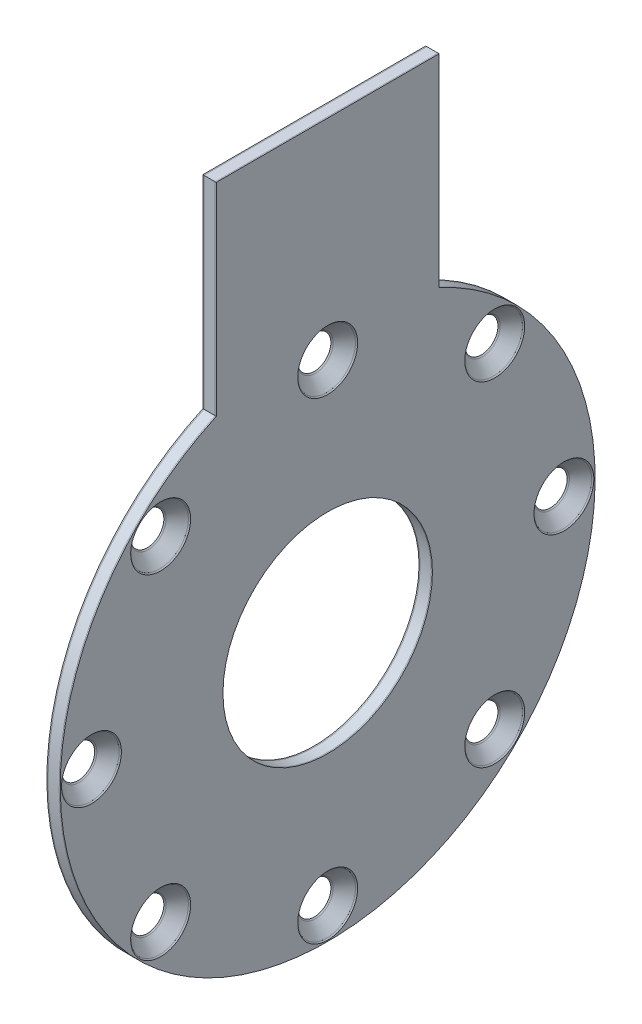
from build123d import *

# Parameters (mm, degrees)
SKETCH1_R                                    = 23.5
BOSS_EXTRUDE1_DEPTH                          = 0.25
SKETCH4_R                                    = 23.5
BOSS_EXTRUDE4_DEPTH                          = 2.5
SKETCH5_R                                    = 23.5
BOSS_EXTRUDE5_DEPTH                          = 0.25
CSK_FOR_M6_HEX_SOCKET_COUNTERSUNK_CA_2_COUNT = 2
CSK_FOR_M6_HEX_SOCKET_COUNTERSUNK_CA_2_PITCH = 40.564443831
CSK_FOR_M6_HEX_SOCKET_COUNTERSUNK_CA_3_COUNT = 2
CSK_FOR_M6_HEX_SOCKET_COUNTERSUNK_CA_3_PITCH = 74.953318806
CSK_FOR_M6_HEX_SOCKET_COUNTERSUNK_CA_4_COUNT = 2
CSK_FOR_M6_HEX_SOCKET_COUNTERSUNK_CA_4_PITCH = 97.931230446
CSK_FOR_M6_HEX_SOCKET_COUNTERSUNK_CA_5_COUNT = 2
CSK_FOR_M6_HEX_SOCKET_COUNTERSUNK_CA_5_PITCH = 106
CSK_FOR_M6_HEX_SOCKET_COUNTERSUNK_CA_6_COUNT = 2
CSK_FOR_M6_HEX_SOCKET_COUNTERSUNK_CA_6_PITCH = 97.931230446
CSK_FOR_M6_HEX_SOCKET_COUNTERSUNK_CA_7_COUNT = 2
CSK_FOR_M6_HEX_SOCKET_COUNTERSUNK_CA_7_PITCH = 74.953318806
CSK_FOR_M6_HEX_SOCKET_COUNTERSUNK_CA_8_COUNT = 2
CSK_FOR_M6_HEX_SOCKET_COUNTERSUNK_CA_8_PITCH = 40.564443831


with BuildPart() as part:
    # Sketch1 → Boss-Extrude1 (new body)
    with BuildSketch(Plane(origin=(0, 0, 0), x_dir=(0, 0, -1), z_dir=(1, 0, 0))):
        with BuildLine():
            Line((25, 100), (-25, 100))
            Line((-25, 100), (-25, 54.543560573))
            ThreePointArc((-25, 54.543560573), (0, -60), (25, 54.543560573))
            Line((25, 54.543560573), (25, 100))
        make_face()
        Circle(SKETCH1_R, mode=Mode.SUBTRACT)
    extrude(amount=BOSS_EXTRUDE1_DEPTH)


with BuildPart() as body_2:
    # Sketch4 → Boss-Extrude4 (new body)
    with BuildSketch(Plane.ZY):
        with BuildLine():
            Line((25, 54.543560573), (25, 100))
            Line((25, 100), (-25, 100))
            Line((-25, 100), (-25, 54.543560573))
            ThreePointArc((-25, 54.543560573), (0, -60), (25, 54.543560573))
        make_face()
        Circle(SKETCH4_R, mode=Mode.SUBTRACT)
    extrude(amount=BOSS_EXTRUDE4_DEPTH)


with BuildPart() as body_3:
    # Sketch5 → Boss-Extrude5 (new body)
    with BuildSketch(Plane.ZY.offset(2.5)):
        with BuildLine():
            Line((25, 54.543560573), (25, 100))
            Line((25, 100), (-25, 100))
            Line((-25, 100), (-25, 54.543560573))
            ThreePointArc((-25, 54.543560573), (0, -60), (25, 54.543560573))
        make_face()
        Circle(SKETCH5_R, mode=Mode.SUBTRACT)
    extrude(amount=BOSS_EXTRUDE5_DEPTH)


with BuildPart() as csk_for_m6_hex_socket_countersunk_cap_sc_tool:
    # Sketch10 → CSK for M6 Hex Socket Countersunk Cap Screw2 (revolve)
    with BuildSketch(Plane(origin=(0.25, 37.476659403, -37.476659403), x_dir=(0, 0, -1), z_dir=(0, 1, 0))):
        Polygon((0, 0), (0, 3), (3.3, 3), (3.3, 3.42), (6.72, 0), align=None)
    csk_for_m6_hex_socket_countersunk_cap_sc = revolve(axis=Axis((6.6, 37.476659403, -37.476659403), (-1, 0, 0)))


with BuildPart() as part_1:
    add(part.part)

    # CSK for M6 Hex Socket Countersunk Cap Screw2: cut by csk_for_m6_hex_socket_countersunk_cap_sc_tool
    add(csk_for_m6_hex_socket_countersunk_cap_sc_tool.part, mode=Mode.SUBTRACT)


with BuildPart() as body_2_1:
    add(body_2.part)

    # CSK for M6 Hex Socket Countersunk Cap Screw2: cut by csk_for_m6_hex_socket_countersunk_cap_sc_tool
    add(csk_for_m6_hex_socket_countersunk_cap_sc_tool.part, mode=Mode.SUBTRACT)


with BuildPart() as body_3_1:
    add(body_3.part)

    # CSK for M6 Hex Socket Countersunk Cap Screw2: cut by csk_for_m6_hex_socket_countersunk_cap_sc_tool
    add(csk_for_m6_hex_socket_countersunk_cap_sc_tool.part, mode=Mode.SUBTRACT)


with BuildPart() as csk_for_m6_hex_socket_countersunk_ca_2_tool:
    # CSK for M6 Hex Socket Countersunk Ca 2: CSK for M6 Hex Socket Countersunk Cap Screw2 ×2
    with Locations(*[Vector(0, -0.9238795325112891, -0.3826834323650842) * (i * CSK_FOR_M6_HEX_SOCKET_COUNTERSUNK_CA_2_PITCH) for i in range(1, CSK_FOR_M6_HEX_SOCKET_COUNTERSUNK_CA_2_COUNT)]):
        add(csk_for_m6_hex_socket_countersunk_cap_sc)


with BuildPart() as part_2:
    add(part_1.part)

    # CSK for M6 Hex Socket Countersunk Ca 2: cut by csk_for_m6_hex_socket_countersunk_ca_2_tool
    add(csk_for_m6_hex_socket_countersunk_ca_2_tool.part, mode=Mode.SUBTRACT)


with BuildPart() as body_2_2:
    add(body_2_1.part)

    # CSK for M6 Hex Socket Countersunk Ca 2: cut by csk_for_m6_hex_socket_countersunk_ca_2_tool
    add(csk_for_m6_hex_socket_countersunk_ca_2_tool.part, mode=Mode.SUBTRACT)


with BuildPart() as body_3_2:
    add(body_3_1.part)

    # CSK for M6 Hex Socket Countersunk Ca 2: cut by csk_for_m6_hex_socket_countersunk_ca_2_tool
    add(csk_for_m6_hex_socket_countersunk_ca_2_tool.part, mode=Mode.SUBTRACT)


with BuildPart() as csk_for_m6_hex_socket_countersunk_ca_3_tool:
    # CSK for M6 Hex Socket Countersunk Ca 3: CSK for M6 Hex Socket Countersunk Cap Screw2 ×2
    with Locations(*[(0, -i * CSK_FOR_M6_HEX_SOCKET_COUNTERSUNK_CA_3_PITCH, 0) for i in range(1, CSK_FOR_M6_HEX_SOCKET_COUNTERSUNK_CA_3_COUNT)]):
        add(csk_for_m6_hex_socket_countersunk_cap_sc)


with BuildPart() as part_3:
    add(part_2.part)

    # CSK for M6 Hex Socket Countersunk Ca 3: cut by csk_for_m6_hex_socket_countersunk_ca_3_tool
    add(csk_for_m6_hex_socket_countersunk_ca_3_tool.part, mode=Mode.SUBTRACT)


with BuildPart() as body_2_3:
    add(body_2_2.part)

    # CSK for M6 Hex Socket Countersunk Ca 3: cut by csk_for_m6_hex_socket_countersunk_ca_3_tool
    add(csk_for_m6_hex_socket_countersunk_ca_3_tool.part, mode=Mode.SUBTRACT)


with BuildPart() as body_3_3:
    add(body_3_2.part)

    # CSK for M6 Hex Socket Countersunk Ca 3: cut by csk_for_m6_hex_socket_countersunk_ca_3_tool
    add(csk_for_m6_hex_socket_countersunk_ca_3_tool.part, mode=Mode.SUBTRACT)


with BuildPart() as csk_for_m6_hex_socket_countersunk_ca_4_tool:
    # CSK for M6 Hex Socket Countersunk Ca 4: CSK for M6 Hex Socket Countersunk Cap Screw2 ×2
    with Locations(*[Vector(0, -0.9238795325112837, 0.382683432365097) * (i * CSK_FOR_M6_HEX_SOCKET_COUNTERSUNK_CA_4_PITCH) for i in range(1, CSK_FOR_M6_HEX_SOCKET_COUNTERSUNK_CA_4_COUNT)]):
        add(csk_for_m6_hex_socket_countersunk_cap_sc)


with BuildPart() as part_4:
    add(part_3.part)

    # CSK for M6 Hex Socket Countersunk Ca 4: cut by csk_for_m6_hex_socket_countersunk_ca_4_tool
    add(csk_for_m6_hex_socket_countersunk_ca_4_tool.part, mode=Mode.SUBTRACT)


with BuildPart() as body_2_4:
    add(body_2_3.part)

    # CSK for M6 Hex Socket Countersunk Ca 4: cut by csk_for_m6_hex_socket_countersunk_ca_4_tool
    add(csk_for_m6_hex_socket_countersunk_ca_4_tool.part, mode=Mode.SUBTRACT)


with BuildPart() as body_3_4:
    add(body_3_3.part)

    # CSK for M6 Hex Socket Countersunk Ca 4: cut by csk_for_m6_hex_socket_countersunk_ca_4_tool
    add(csk_for_m6_hex_socket_countersunk_ca_4_tool.part, mode=Mode.SUBTRACT)


with BuildPart() as csk_for_m6_hex_socket_countersunk_ca_5_tool:
    # CSK for M6 Hex Socket Countersunk Ca 5: CSK for M6 Hex Socket Countersunk Cap Screw2 ×2
    with Locations(*[Vector(0, -0.7071067811865415, 0.7071067811865537) * (i * CSK_FOR_M6_HEX_SOCKET_COUNTERSUNK_CA_5_PITCH) for i in range(1, CSK_FOR_M6_HEX_SOCKET_COUNTERSUNK_CA_5_COUNT)]):
        add(csk_for_m6_hex_socket_countersunk_cap_sc)


with BuildPart() as part_5:
    add(part_4.part)

    # CSK for M6 Hex Socket Countersunk Ca 5: cut by csk_for_m6_hex_socket_countersunk_ca_5_tool
    add(csk_for_m6_hex_socket_countersunk_ca_5_tool.part, mode=Mode.SUBTRACT)


with BuildPart() as body_2_5:
    add(body_2_4.part)

    # CSK for M6 Hex Socket Countersunk Ca 5: cut by csk_for_m6_hex_socket_countersunk_ca_5_tool
    add(csk_for_m6_hex_socket_countersunk_ca_5_tool.part, mode=Mode.SUBTRACT)


with BuildPart() as body_3_5:
    add(body_3_4.part)

    # CSK for M6 Hex Socket Countersunk Ca 5: cut by csk_for_m6_hex_socket_countersunk_ca_5_tool
    add(csk_for_m6_hex_socket_countersunk_ca_5_tool.part, mode=Mode.SUBTRACT)


with BuildPart() as csk_for_m6_hex_socket_countersunk_ca_6_tool:
    # CSK for M6 Hex Socket Countersunk Ca 6: CSK for M6 Hex Socket Countersunk Cap Screw2 ×2
    with Locations(*[Vector(0, -0.3826834323650809, 0.9238795325112904) * (i * CSK_FOR_M6_HEX_SOCKET_COUNTERSUNK_CA_6_PITCH) for i in range(1, CSK_FOR_M6_HEX_SOCKET_COUNTERSUNK_CA_6_COUNT)]):
        add(csk_for_m6_hex_socket_countersunk_cap_sc)


with BuildPart() as part_6:
    add(part_5.part)

    # CSK for M6 Hex Socket Countersunk Ca 6: cut by csk_for_m6_hex_socket_countersunk_ca_6_tool
    add(csk_for_m6_hex_socket_countersunk_ca_6_tool.part, mode=Mode.SUBTRACT)


with BuildPart() as body_2_6:
    add(body_2_5.part)

    # CSK for M6 Hex Socket Countersunk Ca 6: cut by csk_for_m6_hex_socket_countersunk_ca_6_tool
    add(csk_for_m6_hex_socket_countersunk_ca_6_tool.part, mode=Mode.SUBTRACT)


with BuildPart() as body_3_6:
    add(body_3_5.part)

    # CSK for M6 Hex Socket Countersunk Ca 6: cut by csk_for_m6_hex_socket_countersunk_ca_6_tool
    add(csk_for_m6_hex_socket_countersunk_ca_6_tool.part, mode=Mode.SUBTRACT)


with BuildPart() as csk_for_m6_hex_socket_countersunk_ca_7_tool:
    # CSK for M6 Hex Socket Countersunk Ca 7: CSK for M6 Hex Socket Countersunk Cap Screw2 ×2
    with Locations(*[(0, 0, i * CSK_FOR_M6_HEX_SOCKET_COUNTERSUNK_CA_7_PITCH) for i in range(1, CSK_FOR_M6_HEX_SOCKET_COUNTERSUNK_CA_7_COUNT)]):
        add(csk_for_m6_hex_socket_countersunk_cap_sc)


with BuildPart() as part_7:
    add(part_6.part)

    # CSK for M6 Hex Socket Countersunk Ca 7: cut by csk_for_m6_hex_socket_countersunk_ca_7_tool
    add(csk_for_m6_hex_socket_countersunk_ca_7_tool.part, mode=Mode.SUBTRACT)


with BuildPart() as body_2_7:
    add(body_2_6.part)

    # CSK for M6 Hex Socket Countersunk Ca 7: cut by csk_for_m6_hex_socket_countersunk_ca_7_tool
    add(csk_for_m6_hex_socket_countersunk_ca_7_tool.part, mode=Mode.SUBTRACT)


with BuildPart() as body_3_7:
    add(body_3_6.part)

    # CSK for M6 Hex Socket Countersunk Ca 7: cut by csk_for_m6_hex_socket_countersunk_ca_7_tool
    add(csk_for_m6_hex_socket_countersunk_ca_7_tool.part, mode=Mode.SUBTRACT)


with BuildPart() as csk_for_m6_hex_socket_countersunk_ca_8_tool:
    # CSK for M6 Hex Socket Countersunk Ca 8: CSK for M6 Hex Socket Countersunk Cap Screw2 ×2
    with Locations(*[Vector(0, 0.3826834323651002, 0.9238795325112824) * (i * CSK_FOR_M6_HEX_SOCKET_COUNTERSUNK_CA_8_PITCH) for i in range(1, CSK_FOR_M6_HEX_SOCKET_COUNTERSUNK_CA_8_COUNT)]):
        add(csk_for_m6_hex_socket_countersunk_cap_sc)


with BuildPart() as part_8:
    add(part_7.part)

    # CSK for M6 Hex Socket Countersunk Ca 8: cut by csk_for_m6_hex_socket_countersunk_ca_8_tool
    add(csk_for_m6_hex_socket_countersunk_ca_8_tool.part, mode=Mode.SUBTRACT)


with BuildPart() as body_2_8:
    add(body_2_7.part)

    # CSK for M6 Hex Socket Countersunk Ca 8: cut by csk_for_m6_hex_socket_countersunk_ca_8_tool
    add(csk_for_m6_hex_socket_countersunk_ca_8_tool.part, mode=Mode.SUBTRACT)


with BuildPart() as body_3_8:
    add(body_3_7.part)

    # CSK for M6 Hex Socket Countersunk Ca 8: cut by csk_for_m6_hex_socket_countersunk_ca_8_tool
    add(csk_for_m6_hex_socket_countersunk_ca_8_tool.part, mode=Mode.SUBTRACT)


solid = Compound([part_8.part, body_2_8.part, body_3_8.part])
